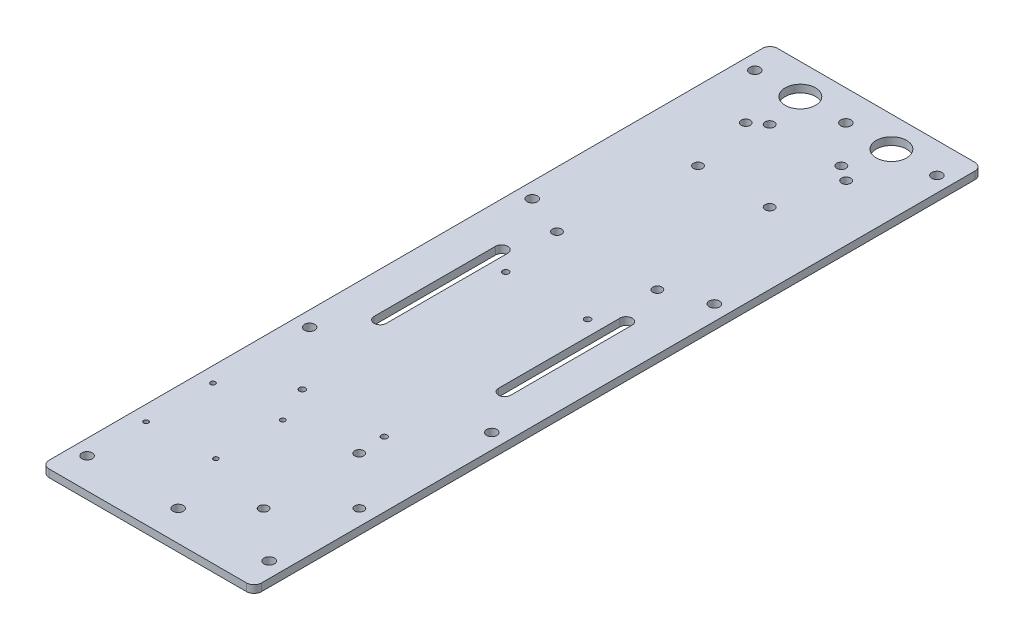
from build123d import *

# Parameters (mm, degrees)
PLATE_THICKNESS_DEPTH        = 3.175
SKETCH3_R                    = 2.159
MOUNTING_HOLES_DEPTH         = 159.781746826
SKETCH4_R                    = 1.905
JETSON_HOLES_W_O_MOUNT_DEPTH = 159.781746826
SKETCH5_R                    = 1.905
PDB_HOLES_DEPTH              = 159.781746826
SKETCH7_R                    = 1.27
PIXHAWK_HOLES_DEPTH          = 159.781746826
BATTERY_HOLES_DEPTH          = 159.781746826
VENTRAL_CAMERA_HOLES_REACH   = 160.782
SKETCH10_R                   = 1
SKETCH12_R                   = 6.35
WIFI_ANTENNA_HOLES_DEPTH     = 159.781746826
SKETCH6_R                    = 1.905
CUT_EXTRUDE1_DEPTH           = 159.781746826


with BuildPart() as part:
    # Sketch2 → Plate Thickness (new body)
    with BuildSketch(Plane(origin=(0, 0, 0), x_dir=(1, 0, 0), z_dir=(0, 1, 0))):
        with BuildLine():
            Line((-41.275, 152.4), (41.275, 152.4))
            ThreePointArc((41.275, 152.4), (43.52006403, 151.47006403), (44.45, 149.225))
            Line((44.45, 149.225), (44.45, -149.225))
            ThreePointArc((44.45, -149.225), (43.52006403, -151.47006403), (41.275, -152.4))
            Line((41.275, -152.4), (-41.275, -152.4))
            ThreePointArc((-41.275, -152.4), (-43.52006403, -151.47006403), (-44.45, -149.225))
            Line((-44.45, -149.225), (-44.45, 149.225))
            ThreePointArc((-44.45, 149.225), (-43.52006403, 151.47006403), (-41.275, 152.4))
        make_face()
    extrude(amount=PLATE_THICKNESS_DEPTH)

    # Sketch3 → Mounting holes (cut, through all)
    with BuildSketch(Plane(origin=(0, 3.175, 0), x_dir=(1, 0, 0), z_dir=(0, 1, 0))):
        with Locations((-38.1, 139.7)):
            Circle(SKETCH3_R)
        with Locations((-38.1, 46.566666666)):
            Circle(SKETCH3_R)
        with Locations((-38.1, -46.56666582)):
            Circle(SKETCH3_R)
        with Locations((-38.1, -139.7)):
            Circle(SKETCH3_R)
        with Locations((38.1, -139.7)):
            Circle(SKETCH3_R)
        with Locations((38.1, -46.56666582)):
            Circle(SKETCH3_R)
        with Locations((38.1, 46.566666666)):
            Circle(SKETCH3_R)
        with Locations((38.1, 139.7)):
            Circle(SKETCH3_R)
        with Locations((0, 139.7)):
            Circle(SKETCH3_R)
        with Locations((0, -139.7)):
            Circle(SKETCH3_R)
    extrude(amount=-MOUNTING_HOLES_DEPTH, mode=Mode.SUBTRACT)

    # Sketch4 → Jetson Holes (w/o mount) (cut, through all)
    with BuildSketch(Plane(origin=(0, 3.175, 0), x_dir=(1, 0, 0), z_dir=(0, 1, 0))):
        with Locations((-21.0058, 118.808268359)):
            Circle(SKETCH4_R)
        with Locations((-21.0058, 39.814268359)):
            Circle(SKETCH4_R)
        with Locations((21.0058, 39.814268359)):
            Circle(SKETCH4_R)
        with Locations((21.0058, 118.808268359)):
            Circle(SKETCH4_R)
    extrude(amount=-JETSON_HOLES_W_O_MOUNT_DEPTH, mode=Mode.SUBTRACT)

    # Sketch5 → PDB holes (cut, through all)
    with BuildSketch(Plane(origin=(0, 3.175, 0), x_dir=(1, 0, 0), z_dir=(0, 1, 0))):
        with Locations((-15.378405846, 123.19)):
            Circle(SKETCH5_R)
        with Locations((14.618994154, 123.19)):
            Circle(SKETCH5_R)
        with Locations((14.618994154, 93.1926)):
            Circle(SKETCH5_R)
        with Locations((-15.378405846, 93.1926)):
            Circle(SKETCH5_R)
    extrude(amount=-PDB_HOLES_DEPTH, mode=Mode.SUBTRACT)

    # Sketch7 → PixHawk Holes (cut, through all)
    with BuildSketch(Plane(origin=(0, 3.175, 0), x_dir=(1, 0, 0), z_dir=(0, 1, 0))):
        with Locations((-17.145, 14.489268954)):
            Circle(SKETCH7_R)
        with Locations((-17.145, -70.600731046)):
            Circle(SKETCH7_R)
        with Locations((17.145, -70.600731046)):
            Circle(SKETCH7_R)
        with Locations((17.145, 14.489268954)):
            Circle(SKETCH7_R)
    extrude(amount=-PIXHAWK_HOLES_DEPTH, mode=Mode.SUBTRACT)

    # Sketch8 → Battery Holes (cut, through all)
    with BuildSketch(Plane(origin=(0, 3.175, 0), x_dir=(1, 0, 0), z_dir=(0, 1, 0))):
        with BuildLine():
            Line((-23.495, 21.689654687), (-23.495, -29.110345313))
            ThreePointArc((-23.495, -29.110345313), (-26.035, -31.650345313), (-28.575, -29.110345313))
            Line((-28.575, -29.110345313), (-28.575, 21.689654687))
            ThreePointArc((-28.575, 21.689654687), (-26.035, 24.229654687), (-23.495, 21.689654687))
        make_face()
        with BuildLine():
            Line((23.495, 21.689654687), (23.495, -29.110345313))
            ThreePointArc((23.495, -29.110345313), (26.035, -31.650345313), (28.575, -29.110345313))
            Line((28.575, -29.110345313), (28.575, 21.689654687))
            ThreePointArc((28.575, 21.689654687), (26.035, 24.229654687), (23.495, 21.689654687))
        make_face()
    extrude(amount=-BATTERY_HOLES_DEPTH, mode=Mode.SUBTRACT)

    # Sketch10 → Ventral Camera holes (cut, up to next)
    with BuildSketch(Plane(origin=(0, 3.175, 0), x_dir=(1, 0, 0), z_dir=(0, 1, 0)), mode=Mode.PRIVATE) as ventral_camera_holes_sk1:
        with Locations((-38.125460092, -87.008641581)):
            Circle(SKETCH10_R)
    ventral_camera_holes_tool1 = extrude(ventral_camera_holes_sk1.sketch, amount=-VENTRAL_CAMERA_HOLES_REACH, mode=Mode.PRIVATE) & part.part
    # Sketch10 → Ventral Camera holes (cut, up to next)
    with BuildSketch(Plane(origin=(0, 3.175, 0), x_dir=(1, 0, 0), z_dir=(0, 1, 0)), mode=Mode.PRIVATE) as ventral_camera_holes_sk2:
        with Locations((-38.1, -115.008630005)):
            Circle(SKETCH10_R)
    ventral_camera_holes_tool2 = extrude(ventral_camera_holes_sk2.sketch, amount=-VENTRAL_CAMERA_HOLES_REACH, mode=Mode.PRIVATE) & part.part
    # Sketch10 → Ventral Camera holes (cut, up to next)
    with BuildSketch(Plane(origin=(0, 3.175, 0), x_dir=(1, 0, 0), z_dir=(0, 1, 0)), mode=Mode.PRIVATE) as ventral_camera_holes_sk3:
        with Locations((-10.126568972, -85.789139736)):
            Circle(SKETCH10_R)
    ventral_camera_holes_tool3 = extrude(ventral_camera_holes_sk3.sketch, amount=-VENTRAL_CAMERA_HOLES_REACH, mode=Mode.PRIVATE) & part.part
    # Sketch10 → Ventral Camera holes (cut, up to next)
    with BuildSketch(Plane(origin=(0, 3.175, 0), x_dir=(1, 0, 0), z_dir=(0, 1, 0)), mode=Mode.PRIVATE) as ventral_camera_holes_sk4:
        with Locations((-10.126568972, -113.789139736)):
            Circle(SKETCH10_R)
    ventral_camera_holes_tool4 = extrude(ventral_camera_holes_sk4.sketch, amount=-VENTRAL_CAMERA_HOLES_REACH, mode=Mode.PRIVATE) & part.part
    add(ventral_camera_holes_tool1.solids().sort_by_distance((-38.12546, 3.175, 87.008642))[0], mode=Mode.SUBTRACT)
    add(ventral_camera_holes_tool2.solids().sort_by_distance((-38.1, 3.175, 115.00863))[0], mode=Mode.SUBTRACT)
    add(ventral_camera_holes_tool3.solids().sort_by_distance((-10.126569, 3.175, 85.78914))[0], mode=Mode.SUBTRACT)
    add(ventral_camera_holes_tool4.solids().sort_by_distance((-10.126569, 3.175, 113.78914))[0], mode=Mode.SUBTRACT)

    # Sketch12 → Wifi antenna holes (cut, through all)
    with BuildSketch(Plane(origin=(0, 3.175, 0), x_dir=(1, 0, 0), z_dir=(0, 1, 0))):
        with Locations((-19.05, 139.7)):
            Circle(SKETCH12_R)
        with Locations((19.05, 139.7)):
            Circle(SKETCH12_R)
    extrude(amount=-WIFI_ANTENNA_HOLES_DEPTH, mode=Mode.SUBTRACT)

    # Sketch6 → Cut-Extrude1 (cut, through all)
    with BuildSketch(Plane(origin=(0, 3.175, 0), x_dir=(1, 0, 0), z_dir=(0, 1, 0))):
        with Locations((37.917522463, -101.796635755)):
            Circle(SKETCH6_R)
        with Locations((17.917522463, -81.862635755)):
            Circle(SKETCH6_R)
        with Locations((17.917522463, -121.862635755)):
            Circle(SKETCH6_R)
    extrude(amount=-CUT_EXTRUDE1_DEPTH, mode=Mode.SUBTRACT)


solid = part.part
